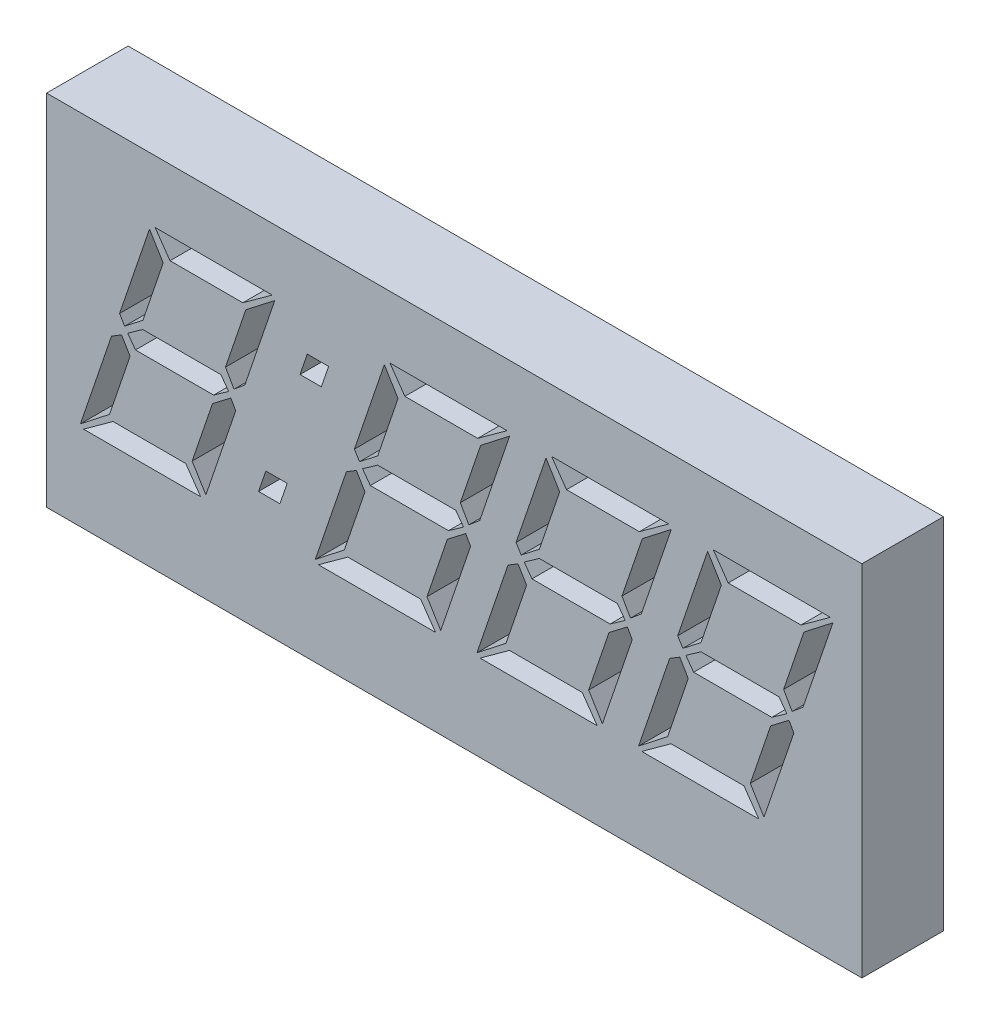
from build123d import *

# Parameters (mm, degrees)
SKETCH_1_W          = 500
SKETCH_1_H          = 220
EXTRUDE_1_DEPTH     = 50
CUT_EXTRUDE_1_DEPTH = 65
SKETCH_3_W          = 24.993501938
SKETCH_3_H          = 24.754329671
EXTRUDE_2_DEPTH     = 50


with BuildPart() as part:
    # Эскиз1 → Бобышка-Вытянуть1 (new body)
    with BuildSketch(Plane.XY):
        with Locations((315.178539616, -203.237931197)):
            Rectangle(SKETCH_1_W, SKETCH_1_H)
        Polygon((203.546220768, -131.339893042), (185.513397027, -144.433418222), (140.884350264, -144.433418222), (131.736418609, -131.339893042), align=None, mode=Mode.SUBTRACT)
        Polygon((159.677066091, -260.404641243), (87.867263933, -260.404641243), (105.900087674, -247.311116064), (150.529134437, -247.311116064), align=None, mode=Mode.SUBTRACT)
        Polygon((116.392443789, -207.416781531), (103.766544509, -244.593040524), (85.938307098, -258.534137646), (104.994062494, -202.419029733), (111.160879041, -198.678022538), align=None, mode=Mode.SUBTRACT)
        Polygon((109.933361055, -187.922626855), (128.287677602, -133.911835488), (136.67571717, -147.706799517), (124.225177602, -184.41543261), (113.060609257, -193.066511747), align=None, mode=Mode.SUBTRACT)
        Polygon((181.158630839, -203.997267143), (162.86276753, -257.832698797), (154.445501343, -244.066961387), (166.92526753, -207.299875056), (178.20674235, -198.678022538), align=None, mode=Mode.SUBTRACT)
        Polygon((174.874907818, -183.947806711), (187.354674005, -147.239173618), (205.124458178, -133.444209589), (186.770141631, -187.455000956), (180.106472566, -193.066511747), align=None, mode=Mode.SUBTRACT)
        Polygon((172.098379041, -189.325504553), (176.833091271, -195.872267143), (167.626706379, -202.419029733), (119.695051703, -202.419029733), (114.931112854, -195.872267143), (124.166724365, -189.325504553), align=None, mode=Mode.SUBTRACT)
        Polygon((188.173019329, -260.404641243), (192.615465372, -247.311116064), (205.708990552, -247.311116064), (201.266544509, -260.404641243), align=None, mode=Mode.SUBTRACT)
        Polygon((220.585339473, -165.00895779), (225.057012134, -151.91543261), (238.150537314, -151.91543261), (233.678864652, -165.00895779), align=None, mode=Mode.SUBTRACT)
        Polygon((347.574997746, -131.339893042), (329.542174005, -144.433418222), (284.913127242, -144.433418222), (275.765195588, -131.339893042), align=None, mode=Mode.SUBTRACT)
        Polygon((303.70584307, -260.404641243), (231.896040911, -260.404641243), (249.928864652, -247.311116064), (294.557911415, -247.311116064), align=None, mode=Mode.SUBTRACT)
        Polygon((260.421220768, -207.416781531), (247.795321487, -244.593040524), (229.967084077, -258.534137646), (249.022839473, -202.419029733), (255.189656019, -198.678022538), align=None, mode=Mode.SUBTRACT)
        Polygon((253.962138034, -187.922626855), (272.31645458, -133.911835488), (280.704494149, -147.706799517), (268.25395458, -184.41543261), (257.089386235, -193.066511747), align=None, mode=Mode.SUBTRACT)
        Polygon((325.187407818, -203.997267143), (306.891544509, -257.832698797), (298.474278321, -244.066961387), (310.954044509, -207.299875056), (322.235519329, -198.678022538), align=None, mode=Mode.SUBTRACT)
        Polygon((318.903684796, -183.947806711), (331.383450983, -147.239173618), (349.153235156, -133.444209589), (330.798918609, -187.455000956), (324.135249545, -193.066511747), align=None, mode=Mode.SUBTRACT)
        Polygon((316.127156019, -189.325504553), (320.86186825, -195.872267143), (311.655483357, -202.419029733), (263.723828681, -202.419029733), (258.959889832, -195.872267143), (268.195501343, -189.325504553), align=None, mode=Mode.SUBTRACT)
        Polygon((446.711688393, -131.339893042), (428.678864652, -144.433418222), (384.04981789, -144.433418222), (374.901886235, -131.339893042), align=None, mode=Mode.SUBTRACT)
        Polygon((402.842533717, -260.404641243), (331.032731559, -260.404641243), (349.0655553, -247.311116064), (393.694602063, -247.311116064), align=None, mode=Mode.SUBTRACT)
        Polygon((359.557911415, -207.416781531), (346.932012134, -244.593040524), (329.103774724, -258.534137646), (348.15953012, -202.419029733), (354.326346667, -198.678022538), align=None, mode=Mode.SUBTRACT)
        Polygon((353.098828681, -187.922626855), (371.453145228, -133.911835488), (379.841184796, -147.706799517), (367.390645228, -184.41543261), (356.226076883, -193.066511747), align=None, mode=Mode.SUBTRACT)
        Polygon((424.324098465, -203.997267143), (406.028235156, -257.832698797), (397.610968969, -244.066961387), (410.090735156, -207.299875056), (421.372209976, -198.678022538), align=None, mode=Mode.SUBTRACT)
        Polygon((418.040375444, -183.947806711), (430.520141631, -147.239173618), (448.289925804, -133.444209589), (429.935609257, -187.455000956), (423.271940192, -193.066511747), align=None, mode=Mode.SUBTRACT)
        Polygon((415.263846667, -189.325504553), (419.998558897, -195.872267143), (410.792174005, -202.419029733), (362.860519329, -202.419029733), (358.09658048, -195.872267143), (367.332191991, -189.325504553), align=None, mode=Mode.SUBTRACT)
        Polygon((545.848379041, -131.339893042), (527.8155553, -144.433418222), (483.186508537, -144.433418222), (474.038576883, -131.339893042), align=None, mode=Mode.SUBTRACT)
        Polygon((501.979224365, -260.404641243), (430.169422206, -260.404641243), (448.202245947, -247.311116064), (492.83129271, -247.311116064), align=None, mode=Mode.SUBTRACT)
        Polygon((458.694602063, -207.416781531), (446.068702782, -244.593040524), (428.240465372, -258.534137646), (447.296220768, -202.419029733), (453.463037314, -198.678022538), align=None, mode=Mode.SUBTRACT)
        Polygon((452.235519329, -187.922626855), (470.589835875, -133.911835488), (478.977875444, -147.706799517), (466.527335875, -184.41543261), (455.36276753, -193.066511747), align=None, mode=Mode.SUBTRACT)
        Polygon((523.460789113, -203.997267143), (505.164925804, -257.832698797), (496.747659616, -244.066961387), (509.227425804, -207.299875056), (520.508900624, -198.678022538), align=None, mode=Mode.SUBTRACT)
        Polygon((517.177066091, -183.947806711), (529.656832278, -147.239173618), (547.426616451, -133.444209589), (529.072299904, -187.455000956), (522.408630839, -193.066511747), align=None, mode=Mode.SUBTRACT)
        Polygon((514.400537314, -189.325504553), (519.135249545, -195.872267143), (509.928864652, -202.419029733), (461.997209976, -202.419029733), (457.233271127, -195.872267143), (466.468882638, -189.325504553), align=None, mode=Mode.SUBTRACT)
    extrude(amount=EXTRUDE_1_DEPTH)

    # Эскиз2 → Вырез-Вытянуть1 (cut)
    with BuildSketch(Plane.XY.offset(50)):
        Polygon((225.057012134, -151.91543261), (238.150537314, -151.91543261), (233.678864652, -165.00895779), (220.585339473, -165.00895779), align=None)
        Polygon((199.643902872, -226.731116064), (212.737428052, -226.731116064), (208.26575539, -239.824641243), (195.17223021, -239.824641243), align=None)
    extrude(amount=-CUT_EXTRUDE_1_DEPTH, mode=Mode.SUBTRACT)

    # Эскиз3 → Бобышка-Вытянуть2 (add)
    with BuildSketch(Plane.XY.offset(50)):
        with Locations((196.457377331, -256.289777907)):
            Rectangle(SKETCH_3_W, SKETCH_3_H)
    extrude(amount=-EXTRUDE_2_DEPTH)


solid = part.part
